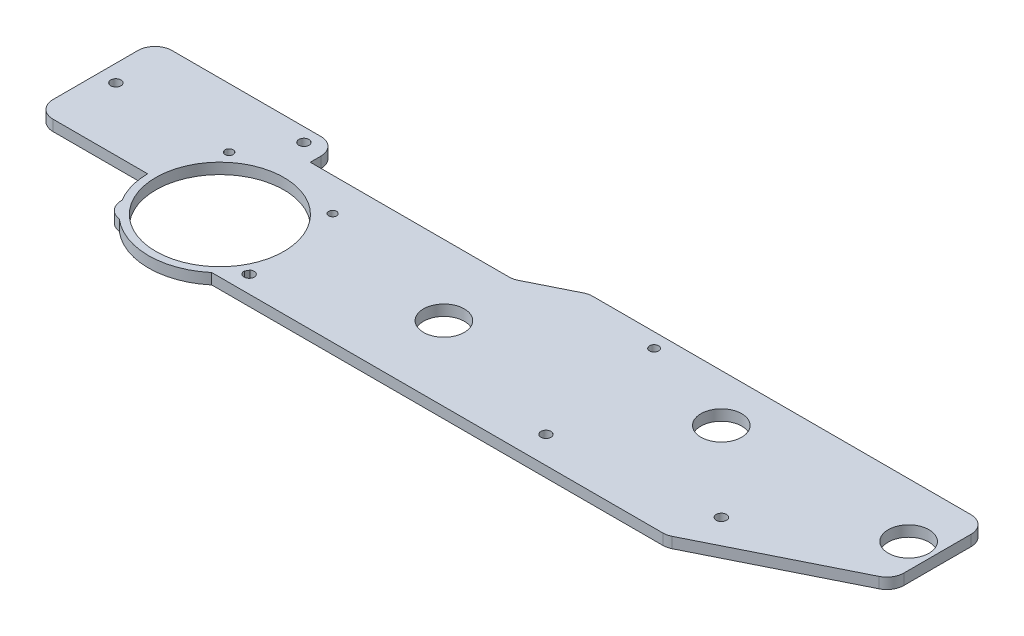
from build123d import *

# Parameters (mm, degrees)
SKETCH1_W           = 210
SKETCH1_H           = 50
SKETCH1_R           = 1.211665018
SKETCH1_R_2         = 1.165617118
SKETCH1_R_3         = 1.5
SKETCH1_R_4         = 1.517273905
SKETCH1_R_5         = 1.335614121
SKETCH1_R_6         = 1.62438417
BOSS_EXTRUDE1_DEPTH = 3.175
SKETCH2_R           = 2
CUT_EXTRUDE1_DEPTH  = 10
SKETCH3_R           = 6
SKETCH3_R_2         = 0.586995366
CUT_EXTRUDE2_DEPTH  = 57.15
CUT_EXTRUDE7_DEPTH  = 10
FILLET3_R           = 5
SKETCH11_R          = 18.5
SKETCH11_R_2        = 2
BOSS_EXTRUDE4_DEPTH = 3.175
SKETCH12_R          = 21
BOSS_EXTRUDE5_DEPTH = 3.175
SKETCH13_R          = 18.85
CUT_EXTRUDE8_DEPTH  = 3.175
BOSS_EXTRUDE6_DEPTH = 3.175
FILLET4_R           = 5
SKETCH15_R          = 1.5
CUT_EXTRUDE9_DEPTH  = 10
SKETCH16_R          = 1.5
CUT_EXTRUDE10_DEPTH = 10
SKETCH17_R          = 1.5
CUT_EXTRUDE11_DEPTH = 10


with BuildPart() as part:
    # Sketch1 → Boss-Extrude1 (new body)
    with BuildSketch(Plane(origin=(0, 0, 0), x_dir=(1, 0, 0), z_dir=(0, 1, 0))):
        with Locations((105, -25)):
            Rectangle(SKETCH1_W, SKETCH1_H)
        with Locations((3.489526233, -16.787661112)):
            Circle(SKETCH1_R, mode=Mode.SUBTRACT)
        with Locations((34.37258772, -17.194005245)):
            Circle(SKETCH1_R_2, mode=Mode.SUBTRACT)
        with Locations((37.520749958, -44.921198121)):
            Circle(SKETCH1_R_3, mode=Mode.SUBTRACT)
        with Locations((168.975233936, -37.403209633)):
            Circle(SKETCH1_R_4, mode=Mode.SUBTRACT)
        with Locations((116, -4.237214774)):
            Circle(SKETCH1_R_5, mode=Mode.SUBTRACT)
        with Locations((12.257640281, -3.274812063)):
            Circle(SKETCH1_R_6, mode=Mode.SUBTRACT)
    extrude(amount=BOSS_EXTRUDE1_DEPTH)

    # Sketch2 → Cut-Extrude1 (cut)
    with BuildSketch(Plane(origin=(0, 3.175, 0), x_dir=(1, 0, 0), z_dir=(0, 1, 0))):
        with Locations((10, -26)):
            Circle(SKETCH2_R)
        with Locations((10, -42)):
            Circle(SKETCH2_R)
        with Locations((26, -26)):
            Circle(SKETCH2_R)
        with Locations((26, -42)):
            Circle(SKETCH2_R)
    extrude(amount=-CUT_EXTRUDE1_DEPTH, mode=Mode.SUBTRACT)

    # Sketch3 → Cut-Extrude2 (cut)
    with BuildSketch(Plane(origin=(0, 3.175, 0), x_dir=(1, 0, 0), z_dir=(0, 1, 0))):
        with Locations((78.01026379, -28.1)):
            Circle(SKETCH3_R)
        with Locations((145.531297368, -14)):
            Circle(SKETCH3_R)
        with Locations((18, -34)):
            Circle(SKETCH3_R_2)
        with Locations((202.646291021, -16)):
            Circle(SKETCH3_R)
    extrude(amount=-CUT_EXTRUDE2_DEPTH, mode=Mode.SUBTRACT)

    # Sketch10 → Cut-Extrude7 (cut)
    with BuildSketch(Plane(origin=(0, 3.175, 0), x_dir=(1, 0, 0), z_dir=(0, 1, 0))):
        Polygon((210, -27.859435908), (165.502877994, -50), (210, -50), align=None)
        Polygon((92.532613397, 0), (77.65477062, -7.402812063), (0, -7.402812063), (0, 0), align=None)
    extrude(amount=-CUT_EXTRUDE7_DEPTH, mode=Mode.SUBTRACT)

    # Fillet3
    fillet3_edges = [part.edges().sort_by_distance(p)[0] for p in [
        (0, 1.5875, 50),
        (0, 1.5875, 7.402812063),
        (77.65477062, 1.5875, 7.402812063),
        (92.532613397, 1.5875, 0),
        (210, 1.5875, 0),
        (210, 1.5875, 27.859435908),
        (165.502877994, 1.5875, 50),
    ]]
    fillet(fillet3_edges, radius=FILLET3_R)

    # Sketch11 → Boss-Extrude4 (add)
    with BuildSketch(Plane(origin=(0, 3.175, 0), x_dir=(1, 0, 0), z_dir=(0, 1, 0))):
        with Locations((18, -34)):
            Circle(SKETCH11_R)
        with Locations((10, -26)):
            Circle(SKETCH11_R_2, mode=Mode.SUBTRACT)
        with Locations((10, -42)):
            Circle(SKETCH11_R_2, mode=Mode.SUBTRACT)
        with Locations((26, -26)):
            Circle(SKETCH11_R_2, mode=Mode.SUBTRACT)
        with Locations((26, -42)):
            Circle(SKETCH11_R_2, mode=Mode.SUBTRACT)
    extrude(amount=-BOSS_EXTRUDE4_DEPTH)

    # Sketch12 → Boss-Extrude5 (add)
    with BuildSketch(Plane(origin=(0, 3.175, 0), x_dir=(1, 0, 0), z_dir=(0, 1, 0))):
        with Locations((18, -34)):
            Circle(SKETCH12_R)
    extrude(amount=-BOSS_EXTRUDE5_DEPTH)

    # Sketch13 → Cut-Extrude8 (cut)
    with BuildSketch(Plane(origin=(0, 3.175, 0), x_dir=(1, 0, 0), z_dir=(0, 1, 0))):
        with Locations((18, -34)):
            Circle(SKETCH13_R)
    extrude(amount=-CUT_EXTRUDE8_DEPTH, mode=Mode.SUBTRACT)

    # Sketch14 → Boss-Extrude6 (add)
    with BuildSketch(Plane(origin=(0, 3.175, 0), x_dir=(1, 0, 0), z_dir=(0, 1, 0))):
        with BuildLine():
            Line((-35.83, -34.272812063), (-2.998227868, -34.272812063))
            ThreePointArc((-2.998227868, -34.272812063), (-2.272136238, -28.519079241), (0, -23.183346174))
            Line((0, -23.183346174), (0, -12.248529085))
            Line((0, -12.248529085), (0.002380891, -12.248529085))
            ThreePointArc((0.002380891, -12.248529085), (1.51944077, -8.813145304), (5, -7.402812063))
            Line((5, -7.402812063), (18, -7.402812063))
            Line((18, -7.402812063), (18, 0.727187937))
            Line((18, 0.727187937), (-35.83, 0.727187937))
            Line((-35.83, 0.727187937), (-35.83, -34.272812063))
        make_face()
    extrude(amount=-BOSS_EXTRUDE6_DEPTH)

    # Fillet4
    fillet4_edges = [part.edges().sort_by_distance(p)[0] for p in [
        (18, 1.5875, -0.727187937),
        (-35.83, 1.5875, 34.272812063),
        (-35.83, 1.5875, -0.727187937),
    ]]
    fillet(fillet4_edges, radius=FILLET4_R)

    # Sketch15 → Cut-Extrude9 (cut)
    with BuildSketch(Plane(origin=(0, 3.175, 0), x_dir=(1, 0, 0), z_dir=(0, 1, 0))):
        with Locations((122, -42.058139805)):
            Circle(SKETCH15_R)
    extrude(amount=-CUT_EXTRUDE9_DEPTH, mode=Mode.SUBTRACT)

    # Sketch16 → Cut-Extrude10 (cut)
    with BuildSketch(Plane(origin=(0, 3.175, 0), x_dir=(1, 0, 0), z_dir=(0, 1, 0))):
        with Locations((12, -3.272812063)):
            Circle(SKETCH16_R)
    extrude(amount=-CUT_EXTRUDE10_DEPTH, mode=Mode.SUBTRACT)

    # Sketch17 → Cut-Extrude11 (cut)
    with BuildSketch(Plane(origin=(0, 3.175, 0), x_dir=(1, 0, 0), z_dir=(0, 1, 0))):
        with Locations((-30.83, -15.772812063)):
            Circle(SKETCH17_R)
    extrude(amount=-CUT_EXTRUDE11_DEPTH, mode=Mode.SUBTRACT)


solid = part.part
